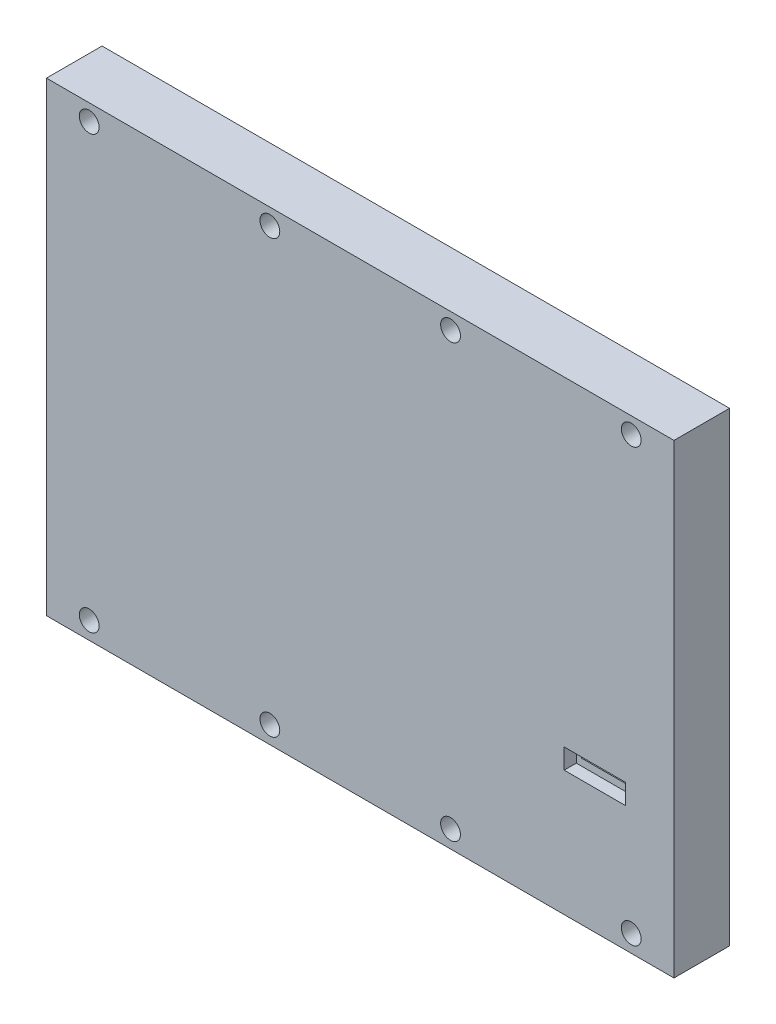
from build123d import *
from OCP.BRepFilletAPI import BRepFilletAPI_MakeChamfer

# Parameters (mm, degrees)
SKETCH1_W               = 180.6
SKETCH1_H               = 134
BOSS_EXTRUDE1_DEPTH     = 0.8
SKETCH1_3_W             = 180.6
SKETCH1_3_H             = 134
SKETCH1_3_W_2           = 172.6
SKETCH1_3_H_2           = 114.6
BOSS_EXTRUDE2_DEPTH     = 16
BOSS_EXTRUDE3_START     = 15.2
BOSS_EXTRUDE3_OUTLINE_W = 172.6
BOSS_EXTRUDE3_OUTLINE_H = 114.6
BOSS_EXTRUDE3_DEPTH     = 0.8
SKETCH2_R               = 1.75
CUT_EXTRUDE1_DEPTH      = 262.731099587
SKETCH3_R               = 2.85
CUT_EXTRUDE2_DEPTH      = 5.8
SKETCH6_R               = 3.95
BOSS_EXTRUDE4_DEPTH     = 3
SKETCH6_3_R             = 3.95
BOSS_EXTRUDE5_DEPTH     = 0.5
SKETCH7_R               = 3.95
BOSS_EXTRUDE6_DEPTH     = 2.5
SKETCH8_R               = 2.5
CUT_EXTRUDE3_DEPTH      = 4
CUT_EXTRUDE4_DEPTH      = 262.683412716
SKETCH9_W               = 17.6
SKETCH9_H               = 5.8
CUT_EXTRUDE5_DEPTH      = 262.683412716
BOSS_EXTRUDE7_START     = -0.8
SKETCH10_W              = 17.6
SKETCH10_H              = 5.8
BOSS_EXTRUDE7_DEPTH     = 4.5
BOSS_EXTRUDE11_START    = -0.8
SKETCH10_4_W            = 1.5
SKETCH10_4_H            = 10
SKETCH10_4_W_2          = 12
SKETCH10_4_H_2          = 1.5
BOSS_EXTRUDE11_DEPTH    = 4.5
SKETCH12_W              = 17.6
SKETCH12_H              = 5.8
SKETCH12_W_2            = 14.6
SKETCH12_H_2            = 2.8
BOSS_EXTRUDE12_DEPTH    = 1
CHAMFER1_SIZE           = 3.7
CHAMFER1_SIZE_2         = 10
FILLET1_R               = 1.5


with BuildPart() as part:
    # Sketch1 → Boss-Extrude1 (new body)
    with BuildSketch(Plane.XY):
        with Locations((162, 0.763400821)):
            Rectangle(SKETCH1_W, SKETCH1_H)
    extrude(amount=BOSS_EXTRUDE1_DEPTH)

    # Sketch1<3> → Boss-Extrude2 (add)
    with BuildSketch(Plane.XY):
        with Locations((162, 0.763400821)):
            Rectangle(SKETCH1_3_W, SKETCH1_3_H)
        with Locations((162, 1.063400821)):
            Rectangle(SKETCH1_3_W_2, SKETCH1_3_H_2, mode=Mode.SUBTRACT)
    extrude(amount=BOSS_EXTRUDE2_DEPTH)

    # Boss-Extrude3: read off the stored shape, not the designer's step
    # Boss-Extrude3 outline → Boss-Extrude3 (add)
    with BuildSketch(Plane.XY.offset(BOSS_EXTRUDE3_START)):
        with Locations((162, 1.063400821)):
            Rectangle(BOSS_EXTRUDE3_OUTLINE_W, BOSS_EXTRUDE3_OUTLINE_H)
    extrude(amount=BOSS_EXTRUDE3_DEPTH)

    # Sketch2 → Cut-Extrude1 (cut, through all)
    with BuildSketch(Plane(origin=(0, 0, 0), x_dir=(-1, 0, 0), z_dir=(0, 0, -1))):
        with Locations((-84, -61.236599179)):
            Circle(SKETCH2_R)
        with Locations((-136, -61.236599179)):
            Circle(SKETCH2_R)
        with Locations((-188, -61.236599179)):
            Circle(SKETCH2_R)
        with Locations((-240, -61.236599179)):
            Circle(SKETCH2_R)
        with Locations((-84, 63.063400821)):
            Circle(SKETCH2_R)
        with Locations((-136, 63.063400821)):
            Circle(SKETCH2_R)
        with Locations((-188, 63.063400821)):
            Circle(SKETCH2_R)
        with Locations((-240, 63.063400821)):
            Circle(SKETCH2_R)
    extrude(amount=-CUT_EXTRUDE1_DEPTH, mode=Mode.SUBTRACT)

    # Sketch3 → Cut-Extrude2 (cut)
    with BuildSketch(Plane.XY.offset(16)):
        with Locations((84, -61.236599179)):
            Circle(SKETCH3_R)
        with Locations((136, -61.236599179)):
            Circle(SKETCH3_R)
        with Locations((188, -61.236599179)):
            Circle(SKETCH3_R)
        with Locations((240, -61.236599179)):
            Circle(SKETCH3_R)
        with Locations((240, 63.063400821)):
            Circle(SKETCH3_R)
        with Locations((188, 63.063400821)):
            Circle(SKETCH3_R)
        with Locations((136, 63.063400821)):
            Circle(SKETCH3_R)
        with Locations((84, 63.063400821)):
            Circle(SKETCH3_R)
    extrude(amount=-CUT_EXTRUDE2_DEPTH, mode=Mode.SUBTRACT)

    # Sketch6 → Boss-Extrude4 (add)
    # profile 1 of 4: a face of its own
    with BuildSketch(Plane.XY.offset(0.8)):
        with Locations((88.75, 36.95)):
            Circle(SKETCH6_R)
        Polygon((91.5, 35.36228676), (91.5, 38.53771324), (88.75, 40.125426481), (86, 38.53771324), (86, 35.36228676), (88.75, 33.774573519), align=None, mode=Mode.SUBTRACT)
    # profile 2 of 4: a face of its own
    with BuildSketch(Plane.XY.offset(0.8)):
        with Locations((88.75, -36.95)):
            Circle(SKETCH6_R)
        Polygon((91.5, -35.36228676), (88.75, -33.774573519), (86, -35.36228676), (86, -38.53771324), (88.75, -40.125426481), (91.5, -38.53771324), align=None, mode=Mode.SUBTRACT)
    # profile 3 of 4: a face of its own
    with BuildSketch(Plane.XY.offset(0.8)):
        with Locations((202.65, -36.95)):
            Circle(SKETCH6_R)
        Polygon((205.4, -38.53771324), (205.4, -35.36228676), (202.65, -33.774573519), (199.9, -35.36228676), (199.9, -38.53771324), (202.65, -40.125426481), align=None, mode=Mode.SUBTRACT)
    # profile 4 of 4: a face of its own
    with BuildSketch(Plane.XY.offset(0.8)):
        with Locations((202.65, 36.95)):
            Circle(SKETCH6_R)
        Polygon((205.4, 35.36228676), (205.4, 38.53771324), (202.65, 40.125426481), (199.9, 38.53771324), (199.9, 35.36228676), (202.65, 33.774573519), align=None, mode=Mode.SUBTRACT)
    extrude(amount=BOSS_EXTRUDE4_DEPTH)

    # Sketch6<3> → Boss-Extrude5 (add)
    with BuildSketch(Plane.XY.offset(0.8)):
        Polygon((86, 35.36228676), (88.75, 33.774573519), (91.5, 35.36228676), (91.5, 38.53771324), (88.75, 40.125426481), (86, 38.53771324), align=None)
        Polygon((199.9, 35.36228676), (202.65, 33.774573519), (205.4, 35.36228676), (205.4, 38.53771324), (202.65, 40.125426481), (199.9, 38.53771324), align=None)
        Polygon((199.9, -38.53771324), (202.65, -40.125426481), (205.4, -38.53771324), (205.4, -35.36228676), (202.65, -33.774573519), (199.9, -35.36228676), align=None)
        Polygon((88.75, -40.125426481), (91.5, -38.53771324), (91.5, -35.36228676), (88.75, -33.774573519), (86, -35.36228676), (86, -38.53771324), align=None)
        with Locations((88.75, 36.95)):
            Circle(SKETCH6_3_R)
    extrude(amount=BOSS_EXTRUDE5_DEPTH)

    # Sketch7 → Boss-Extrude6 (add)
    # profile 1 of 2: a face of its own
    with BuildSketch(Plane.XY.offset(0.8)):
        with Locations((218.5, 4)):
            Circle(SKETCH7_R)
        Polygon((220.08771324, 6.75), (216.91228676, 6.75), (215.324573519, 4), (216.91228676, 1.25), (220.08771324, 1.25), (221.675426481, 4), align=None, mode=Mode.SUBTRACT)
    # profile 2 of 2: a face of its own
    with BuildSketch(Plane.XY.offset(0.8)):
        with Locations((233.4, 33.2)):
            Circle(SKETCH7_R)
        Polygon((234.98771324, 35.95), (231.81228676, 35.95), (230.224573519, 33.2), (231.81228676, 30.45), (234.98771324, 30.45), (236.575426481, 33.2), align=None, mode=Mode.SUBTRACT)
    extrude(amount=BOSS_EXTRUDE6_DEPTH)

    # Sketch8 → Cut-Extrude3 (cut)
    with BuildSketch(Plane.ZY.offset(-71.7)):
        with Locations(Location((8, 0, 0), (0, 0, 270))):
            Circle(SKETCH8_R)
    extrude(amount=-CUT_EXTRUDE3_DEPTH, mode=Mode.SUBTRACT)

    # Sketch4 → Cut-Extrude4 (cut, through all)
    with BuildSketch(Plane.XY.offset(0.8)):
        with BuildLine():
            Line((188.3, -41.236599179), (178.3, -41.236599179))
            ThreePointArc((178.3, -41.236599179), (173.3, -46.236599179), (178.3, -51.236599179))
            Line((178.3, -51.236599179), (188.3, -51.236599179))
            ThreePointArc((188.3, -51.236599179), (193.3, -46.236599179), (188.3, -41.236599179))
        make_face()
    extrude(amount=-CUT_EXTRUDE4_DEPTH, mode=Mode.SUBTRACT)

    # Sketch9 → Cut-Extrude5 (cut, through all)
    with BuildSketch(Plane(origin=(0, 0, 15.2), x_dir=(-1, 0, 0), z_dir=(0, 0, -1))):
        with Locations((-229.5, -27.336599179)):
            Rectangle(SKETCH9_W, SKETCH9_H)
    extrude(amount=-CUT_EXTRUDE5_DEPTH, mode=Mode.SUBTRACT)

    # Sketch10 → Boss-Extrude7 (add)
    with BuildSketch(Plane(origin=(0, 0, 15.2), x_dir=(-1, 0, 0), z_dir=(0, 0, -1)).offset(BOSS_EXTRUDE7_START)):
        Polygon((-220.7, -31.736599179), (-219.2, -31.736599179), (-219.2, -30.236599179), (-219.2, -24.436599179), (-219.2, -22.936599179), (-220.7, -22.936599179), (-227.795416498, -22.936599179), (-229.295416498, -22.936599179), (-237.890832997, -22.936599179), (-248.3, -18.489964731), (-248.3, -20.121097705), (-239.8, -23.752165666), (-239.8, -30.921032692), (-248.3, -34.552100653), (-248.3, -36.183233627), (-237.890832997, -31.736599179), (-229.295416498, -31.736599179), (-227.795416498, -31.736599179), align=None)
        with Locations((-229.5, -27.336599179)):
            Rectangle(SKETCH10_W, SKETCH10_H, mode=Mode.SUBTRACT)
    extrude(amount=BOSS_EXTRUDE7_DEPTH)

    # Sketch10<4> → Boss-Extrude11 (add)
    with BuildSketch(Plane(origin=(0, 0, 15.2), x_dir=(-1, 0, 0), z_dir=(0, 0, -1)).offset(BOSS_EXTRUDE11_START)):
        with Locations((-228.545416498, -17.936599179)):
            Rectangle(SKETCH10_4_W, SKETCH10_4_H)
        with Locations((-219.95, -17.936599179)):
            Rectangle(SKETCH10_4_W, SKETCH10_4_H)
        with Locations((-228.545416498, -36.736599179)):
            Rectangle(SKETCH10_4_W, SKETCH10_4_H)
        with Locations((-219.95, -36.736599179)):
            Rectangle(SKETCH10_4_W, SKETCH10_4_H)
        with Locations((-213.2, -30.986599179)):
            Rectangle(SKETCH10_4_W_2, SKETCH10_4_H_2)
        with Locations((-213.2, -23.686599179)):
            Rectangle(SKETCH10_4_W_2, SKETCH10_4_H_2)
    extrude(amount=BOSS_EXTRUDE11_DEPTH)

    # Sketch12 → Boss-Extrude12 (add)
    with BuildSketch(Plane(origin=(0, 0, 11.5), x_dir=(-1, 0, 0), z_dir=(0, 0, -1))):
        with Locations((-229.5, -27.336599179)):
            Rectangle(SKETCH12_W, SKETCH12_H)
        with Locations((-229.5, -26.836599179)):
            Rectangle(SKETCH12_W_2, SKETCH12_H_2, mode=Mode.SUBTRACT)
    extrude(amount=-BOSS_EXTRUDE12_DEPTH)

    # Chamfer1
    chamfer1_edges_1 = [part.edges().sort_by_distance(p)[0] for p in [
        (228.545416498, -12.936599179, 11.5),
    ]]
    chamfer1_side_1 = [part.faces().sort_by_distance(p)[0] for p in [
        (228.545416498, -12.936599179, 11.574),
    ]]
    chamfer1_edges_2 = [part.edges().sort_by_distance(p)[0] for p in [
        (219.95, -12.936599179, 11.5),
    ]]
    chamfer1_side_2 = [part.faces().sort_by_distance(p)[0] for p in [
        (219.95, -12.936599179, 11.574),
    ]]
    chamfer1_edges_3 = [part.edges().sort_by_distance(p)[0] for p in [
        (207.2, -23.686599179, 11.5),
    ]]
    chamfer1_side_3 = [part.faces().sort_by_distance(p)[0] for p in [
        (207.2, -23.686599179, 11.574),
    ]]
    chamfer1_edges_4 = [part.edges().sort_by_distance(p)[0] for p in [
        (207.2, -30.986599179, 11.5),
    ]]
    chamfer1_side_4 = [part.faces().sort_by_distance(p)[0] for p in [
        (207.2, -30.986599179, 11.574),
    ]]
    chamfer1_edges_5 = [part.edges().sort_by_distance(p)[0] for p in [
        (219.95, -41.736599179, 11.5),
    ]]
    chamfer1_side_5 = [part.faces().sort_by_distance(p)[0] for p in [
        (219.95, -41.736599179, 11.574),
    ]]
    chamfer1_edges_6 = [part.edges().sort_by_distance(p)[0] for p in [
        (228.545416498, -41.736599179, 11.5),
    ]]
    chamfer1_side_6 = [part.faces().sort_by_distance(p)[0] for p in [
        (228.545416498, -41.736599179, 11.574),
    ]]
    chamfer1 = BRepFilletAPI_MakeChamfer(part.part.solid().wrapped)
    for e in chamfer1_edges_1:
        chamfer1.Add(CHAMFER1_SIZE - 0.0001, CHAMFER1_SIZE_2 - 0.0001, e.wrapped, chamfer1_side_1[0].wrapped)
    for e in chamfer1_edges_2:
        chamfer1.Add(CHAMFER1_SIZE - 0.0001, CHAMFER1_SIZE_2 - 0.0001, e.wrapped, chamfer1_side_2[0].wrapped)
    for e in chamfer1_edges_3:
        chamfer1.Add(CHAMFER1_SIZE - 0.0001, CHAMFER1_SIZE_2 - 0.0001, e.wrapped, chamfer1_side_3[0].wrapped)
    for e in chamfer1_edges_4:
        chamfer1.Add(CHAMFER1_SIZE - 0.0001, CHAMFER1_SIZE_2 - 0.0001, e.wrapped, chamfer1_side_4[0].wrapped)
    for e in chamfer1_edges_5:
        chamfer1.Add(CHAMFER1_SIZE - 0.0001, CHAMFER1_SIZE_2 - 0.0001, e.wrapped, chamfer1_side_5[0].wrapped)
    for e in chamfer1_edges_6:
        chamfer1.Add(CHAMFER1_SIZE - 0.0001, CHAMFER1_SIZE_2 - 0.0001, e.wrapped, chamfer1_side_6[0].wrapped)
    add(Compound.cast(chamfer1.Shape()), mode=Mode.REPLACE)  # a hair under: the kernel refuses the full size

    # Fillet1
    # the kernel refuses this fillet: 1.5 mm, written as the material it adds along each edge
    with BuildSketch(Plane(origin=(246.8, -32.28019098, 13.7), x_dir=(-0.39284148462788226, -0.9196062026516358, 0), z_dir=(0, 0, 1))) as fillet1_piece_1_section:
        Polygon((0, 0), (FILLET1_R * 1.02, 0), (FILLET1_R * 1.02, FILLET1_R * 1.54489857748), (-FILLET1_R * 0.40069831432, FILLET1_R * 0.937998326705), align=None)
    fillet1_piece_1 = extrude(amount=FILLET1_R * 1.02, mode=Mode.PRIVATE)
    fillet1_piece_1 = fillet1_piece_1 - Plane(origin=(246.8, -32.28019098, 13.7), x_dir=(-0.5509802697792897, 0.8345182696106427, 0), z_dir=(0, 0, 1)) * Sphere(FILLET1_R, mode=Mode.PRIVATE)
    add(fillet1_piece_1)
    with BuildSketch(Plane(origin=(246.8, -22.393007377, 13.7), x_dir=(-0.39284148462788226, 0.9196062026516358, 0), z_dir=(0, 0, 1))) as fillet1_piece_2_section:
        Polygon((0, 0), (FILLET1_R * 1.02, 0), (FILLET1_R * 1.02, -FILLET1_R * 1.54489857748), (-FILLET1_R * 0.40069831432, -FILLET1_R * 0.937998326705), align=None)
    fillet1_piece_2 = extrude(amount=FILLET1_R * 1.02, mode=Mode.PRIVATE)
    fillet1_piece_2 = fillet1_piece_2 - Plane(origin=(246.8, -22.393007377, 13.7), x_dir=(-0.5509802697792897, -0.8345182696106427, 0), z_dir=(0, 0, 1)) * Sphere(FILLET1_R, mode=Mode.PRIVATE)
    add(fillet1_piece_2)
    with BuildSketch(Plane(origin=(237.583862626, -21.436599179, 13.7), x_dir=(0.39284148462788177, -0.919606202651636, 0), z_dir=(0, 0, 1))) as fillet1_piece_3_section:
        Polygon((0, 0), (FILLET1_R * 1.02, 0), (FILLET1_R * 1.02, -FILLET1_R * 0.208739851834), (FILLET1_R * 0.937998326705, -FILLET1_R * 0.40069831432), align=None)
    fillet1_piece_3 = extrude(amount=FILLET1_R * 1.02, mode=Mode.PRIVATE)
    fillet1_piece_3 = fillet1_piece_3 - Plane(origin=(237.583862626, -21.436599179, 13.7), x_dir=(-0.20049164240481954, 0.9796954125266781, 0), z_dir=(0, 0, 1)) * Sphere(FILLET1_R, mode=Mode.PRIVATE)
    add(fillet1_piece_3)
    with BuildSketch(Plane(origin=(237.583862626, -33.236599179, 13.7), x_dir=(0, 1, 0), z_dir=(0, 0, 1))) as fillet1_piece_4_section:
        Polygon((0, 0), (FILLET1_R * 1.02, 0), (FILLET1_R * 1.02, -FILLET1_R * 0.208739851834), (FILLET1_R * 0.937998326705, -FILLET1_R * 0.40069831432), align=None)
    fillet1_piece_4 = extrude(amount=FILLET1_R * 1.02, mode=Mode.PRIVATE)
    fillet1_piece_4 = fillet1_piece_4 - Plane(origin=(237.583862626, -33.236599179, 13.7), x_dir=(-0.2004916424048197, -0.9796954125266781, 0), z_dir=(0, 0, 1)) * Sphere(FILLET1_R, mode=Mode.PRIVATE)
    add(fillet1_piece_4)
    with BuildSketch(Plane(origin=(248.3, -14.739964731, 11.5), x_dir=(-1, 0, 0), z_dir=(0, -1, 0))) as fillet1_piece_5_section:
        with BuildLine():
            CenterArc((FILLET1_R, FILLET1_R), FILLET1_R, 180, 90)
            Line((0, FILLET1_R), (0, 0))
            Line((0, 0), (FILLET1_R, 0))
        make_face()
    fillet1_piece_5 = extrude(amount=9.131132974, mode=Mode.PRIVATE)
    fillet1_piece_5 = split(fillet1_piece_5, bisect_by=Plane(origin=(250.243985224, -19.290657415, 11.5), z_dir=(-0.39284148462788226, 0.9196062026516358, 0)), keep=Keep.TOP, mode=Mode.PRIVATE)
    fillet1_piece_5 = split(fillet1_piece_5, bisect_by=Plane(origin=(249.654722997, -17.911248111, 11.5), z_dir=(0.39284148462788177, -0.919606202651636, 0)), keep=Keep.TOP, mode=Mode.PRIVATE)
    add(fillet1_piece_5)
    with BuildSketch(Plane(origin=(248.3, -30.802100653, 11.5), x_dir=(-1, 0, 0), z_dir=(0, -1, 0))) as fillet1_piece_6_section:
        with BuildLine():
            CenterArc((FILLET1_R, FILLET1_R), FILLET1_R, 180, 90)
            Line((0, FILLET1_R), (0, 0))
            Line((0, 0), (FILLET1_R, 0))
        make_face()
    fillet1_piece_6 = extrude(amount=9.131132974, mode=Mode.PRIVATE)
    fillet1_piece_6 = split(fillet1_piece_6, bisect_by=Plane(origin=(246.356014776, -35.352793337, 11.5), z_dir=(0.3928414846278821, 0.919606202651636, 0)), keep=Keep.TOP, mode=Mode.PRIVATE)
    fillet1_piece_6 = split(fillet1_piece_6, bisect_by=Plane(origin=(246.945277003, -33.973384033, 11.5), z_dir=(-0.39284148462788226, -0.9196062026516358, 0)), keep=Keep.TOP, mode=Mode.PRIVATE)
    add(fillet1_piece_6)
    with BuildSketch(Plane(origin=(248.3, -36.183233627, 17.675890687), x_dir=(-0.9196062026516343, 0.39284148462788554, 0), z_dir=(0, 0, -1))) as fillet1_piece_7_section:
        with BuildLine():
            CenterArc((FILLET1_R * 0.660237516473, -FILLET1_R), FILLET1_R, 90, 66.868579185)
            Line((-FILLET1_R * 0.259368686178, -FILLET1_R * 0.607158515372), (0, 0))
            Line((0, 0), (FILLET1_R * 0.660237516473, 0))
        make_face()
    fillet1_piece_7 = extrude(amount=6.175890687, mode=Mode.PRIVATE)
    fillet1_piece_7 = split(fillet1_piece_7, bisect_by=Plane(origin=(248.3, -36.183233627, 16), z_dir=(0, 0, -1)), keep=Keep.TOP, mode=Mode.PRIVATE)
    add(fillet1_piece_7)
    with BuildSketch(Plane(origin=(248.3, -32.28019098, 15.2), x_dir=(0, 0, -1), z_dir=(0, 1, 0))) as fillet1_piece_8:
        with BuildLine():
            CenterArc((FILLET1_R, FILLET1_R), FILLET1_R, 180, 90)
            Line((0, FILLET1_R), (0, 0))
            Line((0, 0), (FILLET1_R, 0))
        make_face()
    extrude(amount=9.887183603)
    with BuildSketch(Plane(origin=(248.3, -20.121097705, 13.7), x_dir=(0, -1, 0), z_dir=(0, 0, -1))) as fillet1_piece_9:
        with BuildLine():
            CenterArc((FILLET1_R * 1.51460644851, FILLET1_R), FILLET1_R, 156.868579185, 113.131420815)
            Line((FILLET1_R * 0.59500024586, FILLET1_R * 1.39284148463), (0, 0))
            Line((0, 0), (FILLET1_R * 1.51460644851, 0))
        make_face()
    extrude(amount=2.2)
    with BuildSketch(Plane(origin=(246.210737773, -21.013598073, 15.2), x_dir=(0, 0, -1), z_dir=(-0.9196062026516358, -0.39284148462788226, 0))) as fillet1_piece_10_section:
        with BuildLine():
            CenterArc((FILLET1_R, FILLET1_R), FILLET1_R, 180, 90)
            Line((0, FILLET1_R), (0, 0))
            Line((0, 0), (FILLET1_R, 0))
        make_face()
    fillet1_piece_10 = extrude(amount=10.721177178, mode=Mode.PRIVATE)
    fillet1_piece_10 = split(fillet1_piece_10, bisect_by=Plane(origin=(238.3, -21.013598073, 15.2), z_dir=(1, 0, 0)), keep=Keep.TOP, mode=Mode.PRIVATE)
    add(fillet1_piece_10)
    with BuildSketch(Plane(origin=(239.8, -20.002165666, 15.2), x_dir=(0, 0, -1), z_dir=(0, -1, 0))) as fillet1_piece_11_section:
        with BuildLine():
            CenterArc((FILLET1_R, FILLET1_R), FILLET1_R, 180, 90)
            Line((0, FILLET1_R), (0, 0))
            Line((0, 0), (FILLET1_R, 0))
        make_face()
    fillet1_piece_11 = extrude(amount=14.668867026, mode=Mode.PRIVATE)
    fillet1_piece_11 = split(fillet1_piece_11, bisect_by=Plane(origin=(235.85545593, -29.23598474, 15.2), z_dir=(0.39284148462788226, 0.9196062026516358, 0)), keep=Keep.TOP, mode=Mode.PRIVATE)
    fillet1_piece_11 = split(fillet1_piece_11, bisect_by=Plane(origin=(240.56546077, -21.794039742, 15.2), z_dir=(0.39284148462788177, -0.919606202651636, 0)), keep=Keep.TOP, mode=Mode.PRIVATE)
    add(fillet1_piece_11)
    with BuildSketch(Plane(origin=(248.3, -34.552100653, 13.7), x_dir=(0, 1, 0), z_dir=(0, 0, -1))) as fillet1_piece_12:
        with BuildLine():
            CenterArc((FILLET1_R * 1.51460644851, -FILLET1_R), FILLET1_R, 90, 113.131420815)
            Line((FILLET1_R * 0.59500024586, -FILLET1_R * 1.39284148463), (0, 0))
            Line((0, 0), (FILLET1_R * 1.51460644851, 0))
        make_face()
    extrude(amount=2.2)
    with BuildSketch(Plane(origin=(236.35147674, -29.447877125, 15.2), x_dir=(0, 0, -1), z_dir=(0.9196062026516358, -0.39284148462788226, 0))) as fillet1_piece_13_section:
        with BuildLine():
            CenterArc((FILLET1_R, FILLET1_R), FILLET1_R, 180, 90)
            Line((0, FILLET1_R), (0, 0))
            Line((0, 0), (FILLET1_R, 0))
        make_face()
    fillet1_piece_13 = extrude(amount=10.721177178, mode=Mode.PRIVATE)
    fillet1_piece_13 = split(fillet1_piece_13, bisect_by=Plane(origin=(238.3, -29.447877125, 15.2), z_dir=(1, 0, 0)), keep=Keep.TOP, mode=Mode.PRIVATE)
    add(fillet1_piece_13)
    with BuildSketch(Plane(origin=(248.3, -18.489964731, 17.675890687), x_dir=(0, 1, 0), z_dir=(0, 0, -1))) as fillet1_piece_14_section:
        with BuildLine():
            CenterArc((FILLET1_R * 0.660237516473, -FILLET1_R), FILLET1_R, 90, 66.868579185)
            Line((-FILLET1_R * 0.259368686178, -FILLET1_R * 0.607158515372), (0, 0))
            Line((0, 0), (FILLET1_R * 0.660237516473, 0))
        make_face()
    fillet1_piece_14 = extrude(amount=6.175890687, mode=Mode.PRIVATE)
    fillet1_piece_14 = split(fillet1_piece_14, bisect_by=Plane(origin=(248.3, -18.489964731, 16), z_dir=(0, 0, -1)), keep=Keep.TOP, mode=Mode.PRIVATE)
    add(fillet1_piece_14)
    with BuildSketch(Plane(origin=(238.173124853, -22.816008483, 15.2), x_dir=(-0.39284148462788177, 0.919606202651636, 0), z_dir=(0.919606202651636, 0.39284148462788177, 0)), Plane(origin=(251.74852326, -37.656389194, 15.2), x_dir=(-0.3928414846278821, -0.9196062026516357, 0), z_dir=(-0.919606202651636, 0.3928414846278821, 0))) as fillet1_piece_15:
        with BuildLine():
            CenterArc((FILLET1_R, -FILLET1_R), FILLET1_R, 90, 90)
            Line((0, -FILLET1_R), (0, 0))
            Line((0, 0), (FILLET1_R, 0))
        make_face()
    extrude(amount=14.762186649)
    with BuildSketch(Plane(origin=(237.890832997, -22.936599179, 13.7), x_dir=(-1, 0, 0), z_dir=(0, 0, -1))) as fillet1_piece_16:
        with BuildLine():
            CenterArc((FILLET1_R * 0.204646913562, FILLET1_R), FILLET1_R, 246.868579185, 23.131420815)
            Line((-FILLET1_R * 0.188194571065, FILLET1_R * 0.0803937973484), (0, 0))
            Line((0, 0), (FILLET1_R * 0.204646913562, 0))
        make_face()
    extrude(amount=2.2)
    with BuildSketch(Plane(origin=(225.545416498, -22.936599179, 15.2), x_dir=(0, 0, -1), z_dir=(1, 0, 0))) as fillet1_piece_17:
        with BuildLine():
            CenterArc((FILLET1_R, FILLET1_R), FILLET1_R, 180, 90)
            Line((0, FILLET1_R), (0, 0))
            Line((0, 0), (FILLET1_R, 0))
        make_face()
    extrude(amount=12.038446128)
    with BuildSketch(Plane(origin=(229.295416498, -22.936599179, 18.95), x_dir=(0, 1, 0), z_dir=(0, 0, -1))) as fillet1_piece_18_section:
        with BuildLine():
            CenterArc((FILLET1_R, FILLET1_R), FILLET1_R, 180, 90)
            Line((0, FILLET1_R), (0, 0))
            Line((0, 0), (FILLET1_R, 0))
        make_face()
    fillet1_piece_18 = extrude(amount=7.45, mode=Mode.PRIVATE)
    fillet1_piece_18 = split(fillet1_piece_18, bisect_by=Plane(origin=(229.295416498, -20.512042879, 12.397033557), z_dir=(0, -0.3470036846710527, 0.9378637655996274)), keep=Keep.TOP, mode=Mode.PRIVATE)
    fillet1_piece_18 = split(fillet1_piece_18, bisect_by=Plane(origin=(229.295416498, -22.936599179, 16), z_dir=(0, 0, -1)), keep=Keep.TOP, mode=Mode.PRIVATE)
    add(fillet1_piece_18)
    with BuildSketch(Plane(origin=(227.795416498, -22.936599179, 18.95), x_dir=(-1, 0, 0), z_dir=(0, 0, -1))) as fillet1_piece_19_section:
        with BuildLine():
            CenterArc((FILLET1_R, FILLET1_R), FILLET1_R, 180, 90)
            Line((0, FILLET1_R), (0, 0))
            Line((0, 0), (FILLET1_R, 0))
        make_face()
    fillet1_piece_19 = extrude(amount=7.45, mode=Mode.PRIVATE)
    fillet1_piece_19 = split(fillet1_piece_19, bisect_by=Plane(origin=(227.795416498, -20.512042879, 12.397033557), z_dir=(0, -0.3470036846710527, 0.9378637655996274)), keep=Keep.TOP, mode=Mode.PRIVATE)
    fillet1_piece_19 = split(fillet1_piece_19, bisect_by=Plane(origin=(227.795416498, -22.936599179, 16), z_dir=(0, 0, -1)), keep=Keep.TOP, mode=Mode.PRIVATE)
    add(fillet1_piece_19)
    with BuildSketch(Plane(origin=(220.7, -22.936599179, 15.2), x_dir=(0, 1, 0), z_dir=(1, 0, 0))) as fillet1_piece_20:
        with BuildLine():
            CenterArc((FILLET1_R, -FILLET1_R), FILLET1_R, 90, 90)
            Line((0, -FILLET1_R), (0, 0))
            Line((0, 0), (FILLET1_R, 0))
        make_face()
    extrude(amount=10.845416498)
    with BuildSketch(Plane(origin=(220.7, -22.936599179, 18.95), x_dir=(0, 1, 0), z_dir=(0, 0, -1))) as fillet1_piece_21_section:
        with BuildLine():
            CenterArc((FILLET1_R, FILLET1_R), FILLET1_R, 180, 90)
            Line((0, FILLET1_R), (0, 0))
            Line((0, 0), (FILLET1_R, 0))
        make_face()
    fillet1_piece_21 = extrude(amount=7.45, mode=Mode.PRIVATE)
    fillet1_piece_21 = split(fillet1_piece_21, bisect_by=Plane(origin=(220.7, -20.512042879, 12.397033557), z_dir=(0, -0.34700368467105286, 0.9378637655996273)), keep=Keep.TOP, mode=Mode.PRIVATE)
    fillet1_piece_21 = split(fillet1_piece_21, bisect_by=Plane(origin=(220.7, -22.936599179, 16), z_dir=(0, 0, -1)), keep=Keep.TOP, mode=Mode.PRIVATE)
    add(fillet1_piece_21)
    with BuildSketch(Plane(origin=(219.2, -22.936599179, 18.95), x_dir=(-1, 0, 0), z_dir=(0, 0, -1))) as fillet1_piece_22_section:
        with BuildLine():
            CenterArc((FILLET1_R, FILLET1_R), FILLET1_R, 180, 90)
            Line((0, FILLET1_R), (0, 0))
            Line((0, 0), (FILLET1_R, 0))
        make_face()
    fillet1_piece_22 = extrude(amount=7.45, mode=Mode.PRIVATE)
    fillet1_piece_22 = split(fillet1_piece_22, bisect_by=Plane(origin=(219.2, -20.512042879, 12.397033557), z_dir=(0, -0.34700368467105286, 0.9378637655996273)), keep=Keep.TOP, mode=Mode.PRIVATE)
    fillet1_piece_22 = split(fillet1_piece_22, bisect_by=Plane(origin=(219.2, -22.936599179, 16), z_dir=(0, 0, -1)), keep=Keep.TOP, mode=Mode.PRIVATE)
    add(fillet1_piece_22)
    with BuildSketch(Plane(origin=(219.2, -24.436599179, 18.95), x_dir=(0, -1, 0), z_dir=(0, 0, -1))) as fillet1_piece_23_section:
        with BuildLine():
            CenterArc((FILLET1_R, FILLET1_R), FILLET1_R, 180, 90)
            Line((0, FILLET1_R), (0, 0))
            Line((0, 0), (FILLET1_R, 0))
        make_face()
    fillet1_piece_23 = extrude(amount=7.45, mode=Mode.PRIVATE)
    fillet1_piece_23 = split(fillet1_piece_23, bisect_by=Plane(origin=(219.2, -24.436599179, 16), z_dir=(0, 0, -1)), keep=Keep.TOP, mode=Mode.PRIVATE)
    add(fillet1_piece_23)
    with BuildSketch(Plane(origin=(219.2, -30.236599179, 18.95), x_dir=(-1, 0, 0), z_dir=(0, 0, -1))) as fillet1_piece_24_section:
        with BuildLine():
            CenterArc((FILLET1_R, FILLET1_R), FILLET1_R, 180, 90)
            Line((0, FILLET1_R), (0, 0))
            Line((0, 0), (FILLET1_R, 0))
        make_face()
    fillet1_piece_24 = extrude(amount=7.45, mode=Mode.PRIVATE)
    fillet1_piece_24 = split(fillet1_piece_24, bisect_by=Plane(origin=(219.2, -30.236599179, 16), z_dir=(0, 0, -1)), keep=Keep.TOP, mode=Mode.PRIVATE)
    add(fillet1_piece_24)
    with BuildSketch(Plane(origin=(219.2, -31.736599179, 18.95), x_dir=(0, -1, 0), z_dir=(0, 0, -1))) as fillet1_piece_25_section:
        with BuildLine():
            CenterArc((FILLET1_R, FILLET1_R), FILLET1_R, 180, 90)
            Line((0, FILLET1_R), (0, 0))
            Line((0, 0), (FILLET1_R, 0))
        make_face()
    fillet1_piece_25 = extrude(amount=7.45, mode=Mode.PRIVATE)
    fillet1_piece_25 = split(fillet1_piece_25, bisect_by=Plane(origin=(219.2, -34.161155479, 12.397033557), z_dir=(0, 0.34700368467105275, 0.9378637655996273)), keep=Keep.TOP, mode=Mode.PRIVATE)
    fillet1_piece_25 = split(fillet1_piece_25, bisect_by=Plane(origin=(219.2, -31.736599179, 16), z_dir=(0, 0, -1)), keep=Keep.TOP, mode=Mode.PRIVATE)
    add(fillet1_piece_25)
    with BuildSketch(Plane(origin=(220.7, -31.736599179, 18.95), x_dir=(0, -1, 0), z_dir=(0, 0, -1))) as fillet1_piece_26_section:
        with BuildLine():
            CenterArc((FILLET1_R, -FILLET1_R), FILLET1_R, 90, 90)
            Line((0, -FILLET1_R), (0, 0))
            Line((0, 0), (FILLET1_R, 0))
        make_face()
    fillet1_piece_26 = extrude(amount=7.45, mode=Mode.PRIVATE)
    fillet1_piece_26 = split(fillet1_piece_26, bisect_by=Plane(origin=(220.7, -34.161155479, 12.397033557), z_dir=(0, 0.34700368467105275, 0.9378637655996273)), keep=Keep.TOP, mode=Mode.PRIVATE)
    fillet1_piece_26 = split(fillet1_piece_26, bisect_by=Plane(origin=(220.7, -31.736599179, 16), z_dir=(0, 0, -1)), keep=Keep.TOP, mode=Mode.PRIVATE)
    add(fillet1_piece_26)
    with BuildSketch(Plane(origin=(231.545416498, -31.736599179, 15.2), x_dir=(0, -1, 0), z_dir=(-1, 0, 0))) as fillet1_piece_27_section:
        with BuildLine():
            CenterArc((FILLET1_R, -FILLET1_R), FILLET1_R, 90, 90)
            Line((0, -FILLET1_R), (0, 0))
            Line((0, 0), (FILLET1_R, 0))
        make_face()
    fillet1_piece_27 = extrude(amount=14.595416498, mode=Mode.PRIVATE)
    fillet1_piece_27 = split(fillet1_piece_27, bisect_by=Plane(origin=(219.2, -31.736599179, 15.2), z_dir=(1, 0, 0)), keep=Keep.TOP, mode=Mode.PRIVATE)
    add(fillet1_piece_27)
    with BuildSketch(Plane(origin=(227.795416498, -31.736599179, 18.95), x_dir=(-1, 0, 0), z_dir=(0, 0, -1))) as fillet1_piece_28_section:
        with BuildLine():
            CenterArc((FILLET1_R, -FILLET1_R), FILLET1_R, 90, 90)
            Line((0, -FILLET1_R), (0, 0))
            Line((0, 0), (FILLET1_R, 0))
        make_face()
    fillet1_piece_28 = extrude(amount=7.45, mode=Mode.PRIVATE)
    fillet1_piece_28 = split(fillet1_piece_28, bisect_by=Plane(origin=(227.795416498, -34.161155479, 12.397033557), z_dir=(0, 0.34700368467105275, 0.9378637655996273)), keep=Keep.TOP, mode=Mode.PRIVATE)
    fillet1_piece_28 = split(fillet1_piece_28, bisect_by=Plane(origin=(227.795416498, -31.736599179, 16), z_dir=(0, 0, -1)), keep=Keep.TOP, mode=Mode.PRIVATE)
    add(fillet1_piece_28)
    with BuildSketch(Plane(origin=(229.295416498, -31.736599179, 18.95), x_dir=(0, -1, 0), z_dir=(0, 0, -1))) as fillet1_piece_29_section:
        with BuildLine():
            CenterArc((FILLET1_R, -FILLET1_R), FILLET1_R, 90, 90)
            Line((0, -FILLET1_R), (0, 0))
            Line((0, 0), (FILLET1_R, 0))
        make_face()
    fillet1_piece_29 = extrude(amount=7.45, mode=Mode.PRIVATE)
    fillet1_piece_29 = split(fillet1_piece_29, bisect_by=Plane(origin=(229.295416498, -34.161155479, 12.397033557), z_dir=(0, 0.34700368467105275, 0.9378637655996273)), keep=Keep.TOP, mode=Mode.PRIVATE)
    fillet1_piece_29 = split(fillet1_piece_29, bisect_by=Plane(origin=(229.295416498, -31.736599179, 16), z_dir=(0, 0, -1)), keep=Keep.TOP, mode=Mode.PRIVATE)
    add(fillet1_piece_29)
    with BuildSketch(Plane(origin=(237.583862626, -31.736599179, 15.2), x_dir=(0, -1, 0), z_dir=(-1, 0, 0))) as fillet1_piece_30:
        with BuildLine():
            CenterArc((FILLET1_R, -FILLET1_R), FILLET1_R, 90, 90)
            Line((0, -FILLET1_R), (0, 0))
            Line((0, 0), (FILLET1_R, 0))
        make_face()
    extrude(amount=12.038446128)
    with BuildSketch(Plane(origin=(237.890832997, -31.736599179, 13.7), x_dir=(-1, 0, 0), z_dir=(0, 0, -1))) as fillet1_piece_31:
        with BuildLine():
            CenterArc((FILLET1_R * 0.204646913562, -FILLET1_R), FILLET1_R, 90, 23.131420815)
            Line((-FILLET1_R * 0.188194571065, -FILLET1_R * 0.0803937973483), (0, 0))
            Line((0, 0), (FILLET1_R * 0.204646913562, 0))
        make_face()
    extrude(amount=2.2)
    with BuildSketch(Plane(origin=(248.3, -14.739964731, 11.5), x_dir=(-1, 0, 0), z_dir=(0, -1, 0))) as fillet1_piece_32a_section:
        with BuildLine():
            CenterArc((FILLET1_R, FILLET1_R), FILLET1_R, 180, 90)
            Line((0, FILLET1_R), (0, 0))
            Line((0, 0), (FILLET1_R, 0))
        make_face()
    fillet1_piece_32a = extrude(amount=9.131132974, mode=Mode.PRIVATE)
    fillet1_piece_32a = split(fillet1_piece_32a, bisect_by=Plane(origin=(249.654722997, -17.911248111, 11.5), z_dir=(-0.39284148462788177, 0.919606202651636, 0)), keep=Keep.TOP, mode=Mode.PRIVATE)
    with BuildSketch(Plane(origin=(248.3, -18.489964731, 15.2), x_dir=(0, 1, 0), z_dir=(0, 0, -1))) as fillet1_piece_32b_section:
        with BuildLine():
            CenterArc((FILLET1_R * 0.660237516473, -FILLET1_R), FILLET1_R, 90, 66.868579185)
            Line((-FILLET1_R * 0.259368686178, -FILLET1_R * 0.607158515372), (0, 0))
            Line((0, 0), (FILLET1_R * 0.660237516473, 0))
        make_face()
    fillet1_piece_32b = extrude(amount=6.175890687, mode=Mode.PRIVATE)
    fillet1_piece_32b = split(fillet1_piece_32b, bisect_by=Plane(origin=(248.3, -18.489964731, 11.5), z_dir=(0, 0, -1)), keep=Keep.TOP, mode=Mode.PRIVATE)
    fillet1_piece_32 = fillet1_piece_32a & fillet1_piece_32b
    add(fillet1_piece_32)
    with BuildSketch(Plane(origin=(248.3, -14.739964731, 11.5), x_dir=(-1, 0, 0), z_dir=(0, -1, 0))) as fillet1_piece_33a_section:
        with BuildLine():
            CenterArc((FILLET1_R, FILLET1_R), FILLET1_R, 180, 90)
            Line((0, FILLET1_R), (0, 0))
            Line((0, 0), (FILLET1_R, 0))
        make_face()
    fillet1_piece_33a = extrude(amount=9.131132974, mode=Mode.PRIVATE)
    fillet1_piece_33a = split(fillet1_piece_33a, bisect_by=Plane(origin=(250.243985224, -19.290657415, 11.5), z_dir=(0.39284148462788226, -0.9196062026516358, 0)), keep=Keep.TOP, mode=Mode.PRIVATE)
    with BuildSketch(Plane(origin=(248.3, -20.121097705, 13.7), x_dir=(0, -1, 0), z_dir=(0, 0, -1))) as fillet1_piece_33b_section:
        with BuildLine():
            CenterArc((FILLET1_R * 1.51460644851, FILLET1_R), FILLET1_R, 156.868579185, 113.131420815)
            Line((FILLET1_R * 0.59500024586, FILLET1_R * 1.39284148463), (0, 0))
            Line((0, 0), (FILLET1_R * 1.51460644851, 0))
        make_face()
    fillet1_piece_33b = extrude(amount=7.879774182, mode=Mode.PRIVATE)
    fillet1_piece_33b = split(fillet1_piece_33b, bisect_by=Plane(origin=(248.3, -20.121097705, 11.5), z_dir=(0, 0, -1)), keep=Keep.TOP, mode=Mode.PRIVATE)
    fillet1_piece_33 = fillet1_piece_33a & fillet1_piece_33b
    add(fillet1_piece_33)
    with BuildSketch(Plane(origin=(248.3, -30.802100653, 11.5), x_dir=(-1, 0, 0), z_dir=(0, -1, 0))) as fillet1_piece_34a_section:
        with BuildLine():
            CenterArc((FILLET1_R, FILLET1_R), FILLET1_R, 180, 90)
            Line((0, FILLET1_R), (0, 0))
            Line((0, 0), (FILLET1_R, 0))
        make_face()
    fillet1_piece_34a = extrude(amount=9.131132974, mode=Mode.PRIVATE)
    fillet1_piece_34a = split(fillet1_piece_34a, bisect_by=Plane(origin=(246.945277003, -33.973384033, 11.5), z_dir=(0.39284148462788226, 0.9196062026516358, 0)), keep=Keep.TOP, mode=Mode.PRIVATE)
    with BuildSketch(Plane(origin=(248.3, -34.552100653, 13.7), x_dir=(0, 1, 0), z_dir=(0, 0, -1))) as fillet1_piece_34b_section:
        with BuildLine():
            CenterArc((FILLET1_R * 1.51460644851, -FILLET1_R), FILLET1_R, 90, 113.131420815)
            Line((FILLET1_R * 0.59500024586, -FILLET1_R * 1.39284148463), (0, 0))
            Line((0, 0), (FILLET1_R * 1.51460644851, 0))
        make_face()
    fillet1_piece_34b = extrude(amount=7.879774182, mode=Mode.PRIVATE)
    fillet1_piece_34b = split(fillet1_piece_34b, bisect_by=Plane(origin=(248.3, -34.552100653, 11.5), z_dir=(0, 0, -1)), keep=Keep.TOP, mode=Mode.PRIVATE)
    fillet1_piece_34 = fillet1_piece_34a & fillet1_piece_34b
    add(fillet1_piece_34)
    with BuildSketch(Plane(origin=(248.3, -30.802100653, 11.5), x_dir=(-1, 0, 0), z_dir=(0, -1, 0))) as fillet1_piece_35a_section:
        with BuildLine():
            CenterArc((FILLET1_R, FILLET1_R), FILLET1_R, 180, 90)
            Line((0, FILLET1_R), (0, 0))
            Line((0, 0), (FILLET1_R, 0))
        make_face()
    fillet1_piece_35a = extrude(amount=9.131132974, mode=Mode.PRIVATE)
    fillet1_piece_35a = split(fillet1_piece_35a, bisect_by=Plane(origin=(246.356014776, -35.352793337, 11.5), z_dir=(-0.3928414846278821, -0.919606202651636, 0)), keep=Keep.TOP, mode=Mode.PRIVATE)
    with BuildSketch(Plane(origin=(248.3, -36.183233627, 15.2), x_dir=(-0.9196062026516343, 0.39284148462788554, 0), z_dir=(0, 0, -1))) as fillet1_piece_35b_section:
        with BuildLine():
            CenterArc((FILLET1_R * 0.660237516473, -FILLET1_R), FILLET1_R, 90, 66.868579185)
            Line((-FILLET1_R * 0.259368686178, -FILLET1_R * 0.607158515372), (0, 0))
            Line((0, 0), (FILLET1_R * 0.660237516473, 0))
        make_face()
    fillet1_piece_35b = extrude(amount=6.175890687, mode=Mode.PRIVATE)
    fillet1_piece_35b = split(fillet1_piece_35b, bisect_by=Plane(origin=(248.3, -36.183233627, 11.5), z_dir=(0, 0, -1)), keep=Keep.TOP, mode=Mode.PRIVATE)
    fillet1_piece_35 = fillet1_piece_35a & fillet1_piece_35b
    add(fillet1_piece_35)


solid = part.part
